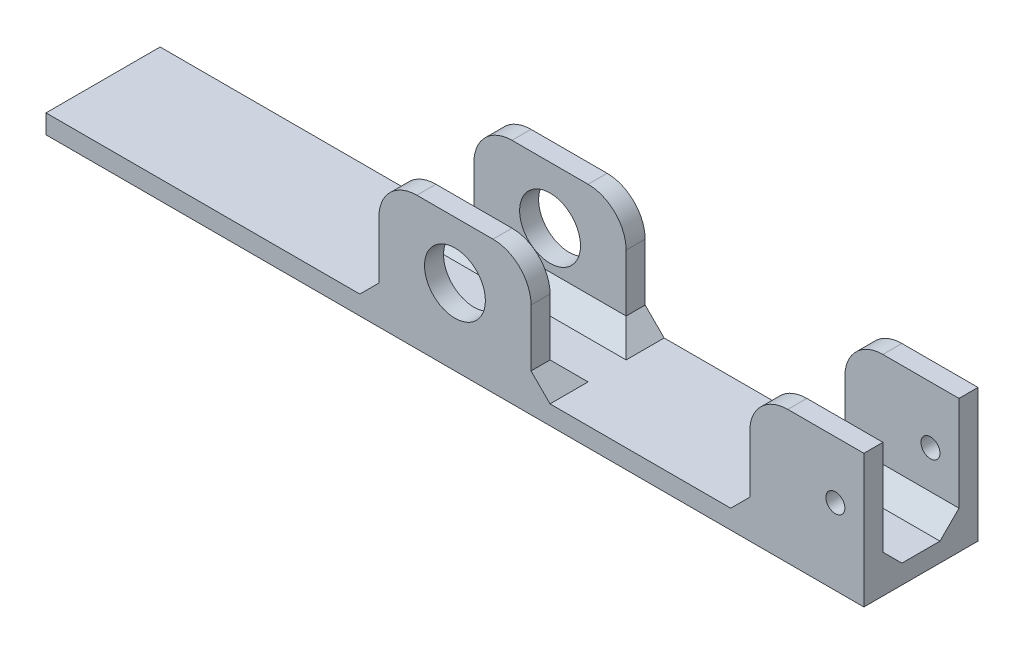
from build123d import *

# Parameters (mm, degrees)
SKETCH2_W           = 215
SKETCH2_H           = 30
BOSS_EXTRUDE1_DEPTH = 5
SKETCH4_W           = 30
SKETCH4_H           = 5
SKETCH4_W_2         = 40
BOSS_EXTRUDE2_DEPTH = 30
SKETCH5_R           = 8
SKETCH5_R_2         = 2.5
BEARING_HOLES_DEPTH = 117.966875653
CHAMFER1_SIZE       = 5
FILLET1_R           = 10


with BuildPart() as part:
    # Sketch2 → Boss-Extrude1 (new body)
    with BuildSketch(Plane(origin=(0, 0, 0), x_dir=(1, 0, 0), z_dir=(0, 1, 0))):
        Rectangle(SKETCH2_W, SKETCH2_H)
    extrude(amount=BOSS_EXTRUDE1_DEPTH)

    # Sketch4 → Boss-Extrude2 (add)
    with BuildSketch(Plane(origin=(0, 5, 0), x_dir=(1, 0, 0), z_dir=(0, 1, 0))):
        with Locations((92.5, -12.5)):
            Rectangle(SKETCH4_W, SKETCH4_H)
        with Locations((0, -12.5)):
            Rectangle(SKETCH4_W_2, SKETCH4_H)
        with Locations((0, 12.5)):
            Rectangle(SKETCH4_W_2, SKETCH4_H)
        with Locations((92.5, 12.5)):
            Rectangle(SKETCH4_W, SKETCH4_H)
    extrude(amount=BOSS_EXTRUDE2_DEPTH)

    # Sketch5 → Bearing holes (cut, through all)
    with BuildSketch(Plane.XY.offset(15)):
        with Locations((0, 20)):
            Circle(SKETCH5_R)
        with Locations((100, 20)):
            Circle(SKETCH5_R_2)
    extrude(amount=-BEARING_HOLES_DEPTH, mode=Mode.SUBTRACT)

    # Chamfer1
    chamfer1_edges = [part.edges().sort_by_distance(p)[0] for p in [
        (92.5, 5, -10),
        (0, 5, -10),
        (0, 5, 10),
        (92.5, 5, 10),
        (77.5, 5, -12.5),
        (-20, 5, -12.5),
        (20, 5, -12.5),
        (-20, 5, 12.5),
        (20, 5, 12.5),
        (77.5, 5, 12.5),
    ]]
    chamfer(chamfer1_edges, length=CHAMFER1_SIZE)

    # Fillet1
    fillet1_edges = [part.edges().sort_by_distance(p)[0] for p in [
        (-20, 35, 12.5),
        (-20, 35, -12.5),
        (20, 35, -12.5),
        (20, 35, 12.5),
        (77.5, 35, 12.5),
        (77.5, 35, -12.5),
    ]]
    fillet(fillet1_edges, radius=FILLET1_R)


solid = part.part
